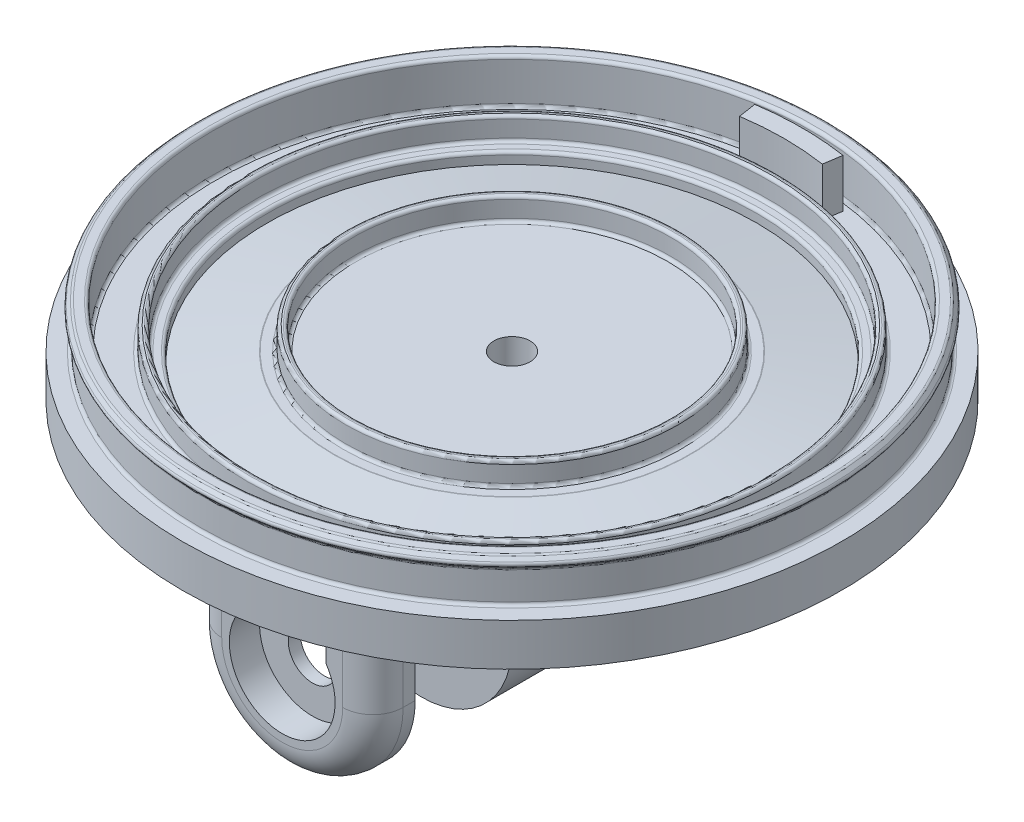
from build123d import *

# Parameters (mm, degrees)
SKETCH2_R                = 54.5
BOSS_EXTRUDE1_DEPTH      = 7
SKETCH4_R                = 43.75
SKETCH4_R_2              = 42.5
SKETCH4_R_3              = 27.5
SKETCH4_R_4              = 26.25
BOSS_EXTRUDE2_DEPTH      = 3.723
FILLET1_R                = 0.5
FILLET2_R                = 0.5
SKETCH6_R                = 3
CUT_EXTRUDE1_DEPTH       = 6
BOSS_EXTRUDE3_DEPTH      = 15
BOSS_EXTRUDE3_DEPTH_BACK = 15
SKETCH7_R                = 4
CUT_EXTRUDE4_DEPTH       = 5
CUT_EXTRUDE4_DEPTH_BACK  = 5
SKETCH10_W               = 38.473117609
SKETCH10_H               = 42.182403499
BOSS_EXTRUDE4_START      = 16
SKETCH11_R               = 4
BOSS_EXTRUDE4_DEPTH      = 2
BOSS_EXTRUDE5_DEPTH      = 5
FILLET3_R                = 5
BOSS_EXTRUDE6_DEPTH      = 8


with BuildPart() as part:
    # Sketch2 → Boss-Extrude1 (new body)
    with BuildSketch(Plane(origin=(0, 0, 0), x_dir=(1, 0, 0), z_dir=(0, 1, 0))):
        Circle(SKETCH2_R)
    extrude(amount=BOSS_EXTRUDE1_DEPTH)

    # Sketch3 → Cut-Revolve1 (revolve, cut)
    with BuildSketch(Plane.XY):
        Polygon((-29.5, 7), (-40.5, 7), (-40.5, 5.127), align=None)
    revolve(axis=Axis((0, 0, 0), (0, 1, 0)), mode=Mode.SUBTRACT)

    # Sketch4 → Boss-Extrude2 (add)
    # profile 1 of 2: a face of its own
    with BuildSketch(Plane(origin=(0, 7, 0), x_dir=(1, 0, 0), z_dir=(0, 1, 0))):
        Circle(SKETCH4_R)
        Circle(SKETCH4_R_2, mode=Mode.SUBTRACT)
    # profile 2 of 2: a face of its own
    with BuildSketch(Plane(origin=(0, 7, 0), x_dir=(1, 0, 0), z_dir=(0, 1, 0))):
        Circle(SKETCH4_R_3)
        Circle(SKETCH4_R_4, mode=Mode.SUBTRACT)
    extrude(amount=BOSS_EXTRUDE2_DEPTH)

    # Fillet1
    fillet1_edges = [part.edges().sort_by_distance(p)[0] for p in [
        (-26.25, 7, 0),
        (29.5, 7, 0),
        (40.5, 7, 0),
        (-43.75, 10.723, 0),
        (-42.5, 7, 0),
        (-42.5, 10.723, 0),
        (-27.5, 7, 0),
        (-27.5, 10.723, 0),
        (-26.25, 10.723, 0),
        (-43.75, 7, 0),
    ]]
    fillet(fillet1_edges, radius=FILLET1_R)

    # Sketch5 → Revolve1 (revolve)
    with BuildSketch(Plane.XY):
        Polygon((-49.5, 7), (-51.5, 7), (-51.5, 12.323), (-52.5, 13.323), (-51.5, 14.323), (-49.5, 14.323), align=None)
    revolve(axis=Axis((0, 7, 0), (0, 1, 0)))

    # Fillet2
    fillet2_edges = [part.edges().sort_by_distance(p)[0] for p in [
        (51.5, 7, 0),
        (49.5, 7, 0),
        (49.5, 14.323, 0),
        (51.5, 14.323, 0),
        (51.5, 12.323, 0),
        (52.5, 13.323, 0),
    ]]
    fillet(fillet2_edges, radius=FILLET2_R)

    # Sketch6 → Cut-Extrude1 (cut)
    with BuildSketch(Plane(origin=(0, 7, 0), x_dir=(1, 0, 0), z_dir=(0, 1, 0))):
        Circle(SKETCH6_R)
    extrude(amount=-CUT_EXTRUDE1_DEPTH, mode=Mode.SUBTRACT)

    # Sketch7 → Boss-Extrude3 (add, two sides: drawn at the far end of the back side and taken through both)
    with BuildSketch(Plane.XY.offset(-BOSS_EXTRUDE3_DEPTH_BACK)):
        with BuildLine():
            Line((15, 0), (-15, 0))
            Line((-15, 0), (-15, -20))
            ThreePointArc((-15, -20), (0, -35), (15, -20))
            Line((15, -20), (15, 0))
        make_face()
        with Locations((0, -20)):
            Circle(SKETCH7_R, mode=Mode.SUBTRACT)
    extrude(amount=BOSS_EXTRUDE3_DEPTH + BOSS_EXTRUDE3_DEPTH_BACK)

    # Sketch10 → Cut-Extrude4 (cut, two sides: drawn at the far end of the back side and taken through both)
    with BuildSketch(Plane.XY.offset(-CUT_EXTRUDE4_DEPTH_BACK)):
        with Locations((1.71649294, -21.09120175)):
            Rectangle(SKETCH10_W, SKETCH10_H)
    extrude(amount=CUT_EXTRUDE4_DEPTH + CUT_EXTRUDE4_DEPTH_BACK, mode=Mode.SUBTRACT)

    # Sketch11 → Boss-Extrude4 (add)
    with BuildSketch(Plane.XY.offset(15).offset(BOSS_EXTRUDE4_START)):
        with BuildLine():
            Line((15, -20), (15, 0))
            Line((15, 0), (-15, 0))
            Line((-15, 0), (-15, -20))
            ThreePointArc((-15, -20), (0, -35), (15, -20))
        make_face()
        with Locations((0, -20)):
            Circle(SKETCH11_R, mode=Mode.SUBTRACT)
    extrude(amount=BOSS_EXTRUDE4_DEPTH)

    # Sketch12 → Boss-Extrude5 (add)
    with BuildSketch(Plane.XY.offset(33)):
        with BuildLine():
            Line((-7.25, -15.101020514), (-7.25, 0))
            Line((-7.25, 0), (-15, 0))
            Line((-15, 0), (-15, -20))
            ThreePointArc((-15, -20), (0, -35), (15, -20))
            Line((15, -20), (15, 0))
            Line((15, 0), (7.25, 0))
            Line((7.25, 0), (7.25, -15.101020514))
            ThreePointArc((7.25, -15.101020514), (8.366600265, -17.438262309), (8.75, -20))
            ThreePointArc((8.75, -20), (-2.561737691, -28.366600265), (-7.25, -15.101020514))
        make_face()
    extrude(amount=BOSS_EXTRUDE5_DEPTH)

    # Fillet3
    fillet3_edges = [part.edges().sort_by_distance(p)[0] for p in [
        (-15, -10, 38),
        (0, -35, 38),
        (15, -10, 38),
    ]]
    fillet(fillet3_edges, radius=FILLET3_R)
    fillet3_2_edges = [part.edges().sort_by_distance(p)[0] for p in [
        (8.625, 0, 38),
    ]]
    fillet(fillet3_2_edges, radius=FILLET3_R)
    fillet3_3_edges = [part.edges().sort_by_distance(p)[0] for p in [
        (-8.625, 0, 38),
    ]]
    fillet(fillet3_3_edges, radius=FILLET3_R)

    # Sketch13 → Boss-Extrude6 (add)
    with BuildSketch(Plane(origin=(0, 7, 0), x_dir=(1, 0, 0), z_dir=(0, 1, 0))):
        with BuildLine():
            Line((7.301922537, 47.441352502), (6.845552379, 44.476267971))
            ThreePointArc((6.845552379, 44.476267971), (0, 45), (-6.845552379, 44.476267971))
            Line((-6.845552379, 44.476267971), (-7.301922537, 47.441352502))
            ThreePointArc((-7.301922537, 47.441352502), (0, 48), (7.301922537, 47.441352502))
        make_face()
    extrude(amount=BOSS_EXTRUDE6_DEPTH)


solid = part.part
